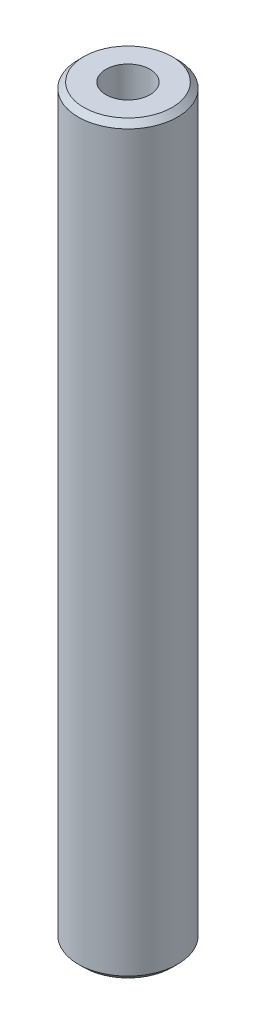
from build123d import *

# Parameters (mm, degrees)
SKETCH1_R           = 40
BOSS_EXTRUDE1_DEPTH = 600
SKETCH2_R           = 17.765096026
CUT_EXTRUDE1_DEPTH  = 603.660766933
CHAMFER1_SIZE       = 4.469837383


with BuildPart() as part:
    # Sketch1 → Boss-Extrude1 (new body)
    with BuildSketch(Plane(origin=(0, 0, 0), x_dir=(1, 0, 0), z_dir=(0, 1, 0))):
        Circle(SKETCH1_R)
    extrude(amount=BOSS_EXTRUDE1_DEPTH)

    # Sketch2 → Cut-Extrude1 (cut, through all)
    with BuildSketch(Plane(origin=(0, 0, 0), x_dir=(1, 0, 0), z_dir=(0, 1, 0))):
        Circle(SKETCH2_R)
    extrude(amount=CUT_EXTRUDE1_DEPTH, mode=Mode.SUBTRACT)

    # Chamfer1
    chamfer1_edges = [part.edges().sort_by_distance(p)[0] for p in [
        (-40, 600, 0),
        (-40, 0, 0),
    ]]
    chamfer(chamfer1_edges, length=CHAMFER1_SIZE)


solid = part.part
